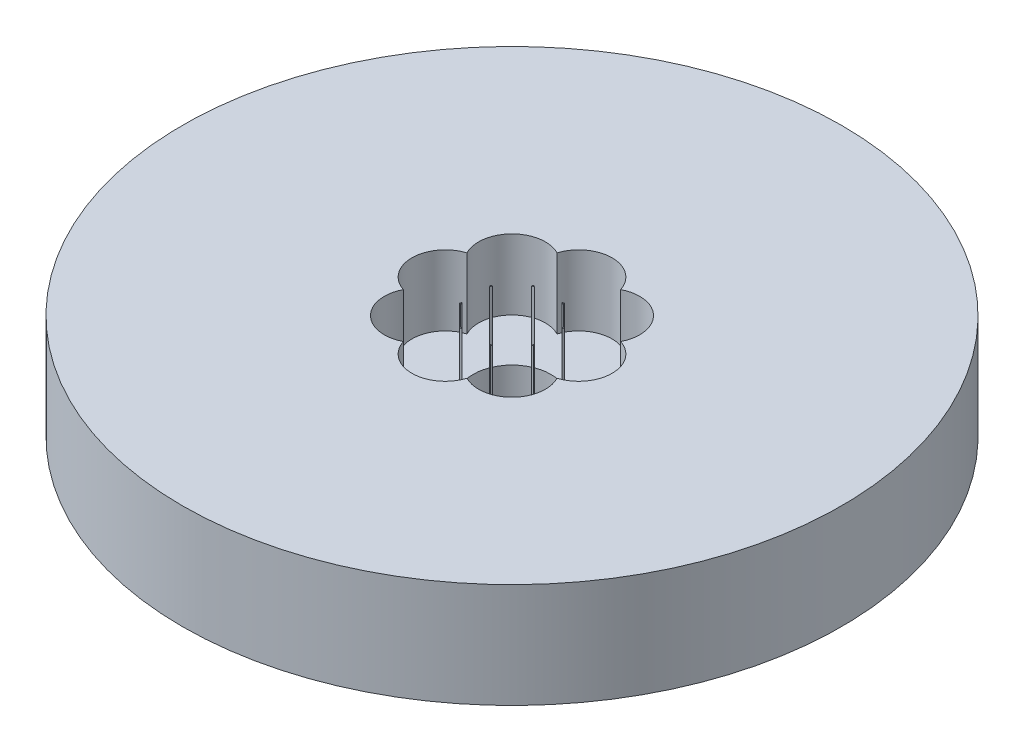
from build123d import *

# Parameters (mm, degrees)
SKETCH1_R           = 85
BOSS_EXTRUDE1_DEPTH = 27
SKETCH2_R           = 10
CUT_EXTRUDE1_DEPTH  = 124.203084377
SKETCH3_R           = 8.611328572
CUT_EXTRUDE2_DEPTH  = 18.121123797
CIRPATTERN1_COUNT   = 8


with BuildPart() as part:
    # Sketch1 → Boss-Extrude1 (new body)
    with BuildSketch(Plane(origin=(0, 0, 0), x_dir=(1, 0, 0), z_dir=(0, 1, 0))):
        Circle(SKETCH1_R)
    extrude(amount=BOSS_EXTRUDE1_DEPTH)

    # Sketch2 → Cut-Extrude1 (cut, through all)
    with BuildSketch(Plane(origin=(0, 0, 0), x_dir=(1, 0, 0), z_dir=(0, 1, 0))):
        Circle(SKETCH2_R)
    extrude(amount=CUT_EXTRUDE1_DEPTH, mode=Mode.SUBTRACT)

    # Sketch3 → Cut-Extrude2 (cut)
    with BuildSketch(Plane(origin=(0, 27, 0), x_dir=(1, 0, 0), z_dir=(0, 1, 0))):
        with Locations((-17.200656016, 0)):
            Circle(SKETCH3_R)
    cut_extrude2 = extrude(amount=-CUT_EXTRUDE2_DEPTH, mode=Mode.SUBTRACT)

    # CirPattern1: Cut-Extrude2 ×8 about axis
    cirpattern1_axis = Axis((0, 0, 0), (0, 1, 0))
    for i in range(1, CIRPATTERN1_COUNT):
        add(cut_extrude2.rotate(cirpattern1_axis, i * 360 / CIRPATTERN1_COUNT), mode=Mode.SUBTRACT)


solid = part.part
